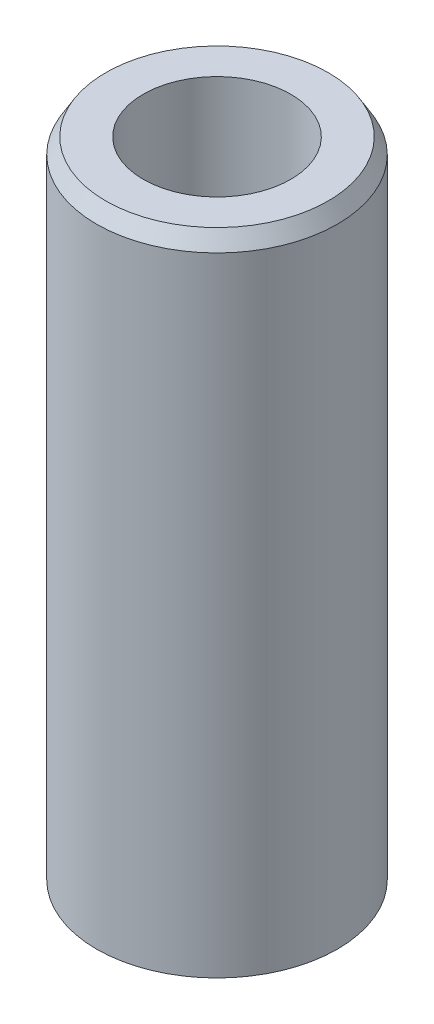
from build123d import *
from OCP.BRepFilletAPI import BRepFilletAPI_MakeChamfer

# Parameters (mm, degrees)
SKETCH1_R           = 20
BOSS_EXTRUDE1_DEPTH = 108.387746694
SKETCH2_R           = 12.255545424
CUT_EXTRUDE1_DEPTH  = 113.017425579
CHAMFER1_SIZE       = 2.575008648
CHAMFER1_SIZE2      = 1.529502968


with BuildPart() as part:
    # Sketch1 → Boss-Extrude1 (new body)
    with BuildSketch(Plane(origin=(0, 0, 0), x_dir=(1, 0, 0), z_dir=(0, 1, 0))):
        Circle(SKETCH1_R)
    extrude(amount=BOSS_EXTRUDE1_DEPTH)

    # Sketch2 → Cut-Extrude1 (cut, through all)
    with BuildSketch(Plane(origin=(0, 0, 0), x_dir=(1, 0, 0), z_dir=(0, 1, 0))):
        Circle(SKETCH2_R)
    extrude(amount=CUT_EXTRUDE1_DEPTH, mode=Mode.SUBTRACT)

    # Chamfer1: one chamfer whose edges measure the first distance from different faces: ONE call of the kernel's chamfer builder (chamfer() names one face for all edges)
    chamfer1_edges_1 = [part.edges().sort_by_distance(p)[0] for p in [
        (-20, 108.387746694, 0),
    ]]
    chamfer1_side_1 = [part.faces().sort_by_distance(p)[0] for p in [
        (-20, 54.193873347, 0),
    ]]
    chamfer1_edges_2 = [part.edges().sort_by_distance(p)[0] for p in [
        (-20, 0, 0),
    ]]
    chamfer1_side_2 = [part.faces().sort_by_distance(p)[0] for p in [
        (-19.434314575, 0, 0),
    ]]
    chamfer1 = BRepFilletAPI_MakeChamfer(part.part.solid().wrapped)
    for e in chamfer1_edges_1:
        chamfer1.Add(CHAMFER1_SIZE, CHAMFER1_SIZE2, e.wrapped, chamfer1_side_1[0].wrapped)  # the first distance lies on this face
    for e in chamfer1_edges_2:
        chamfer1.Add(CHAMFER1_SIZE, CHAMFER1_SIZE2, e.wrapped, chamfer1_side_2[0].wrapped)  # the first distance lies on this face
    add(Compound.cast(chamfer1.Shape()), mode=Mode.REPLACE)


solid = part.part
